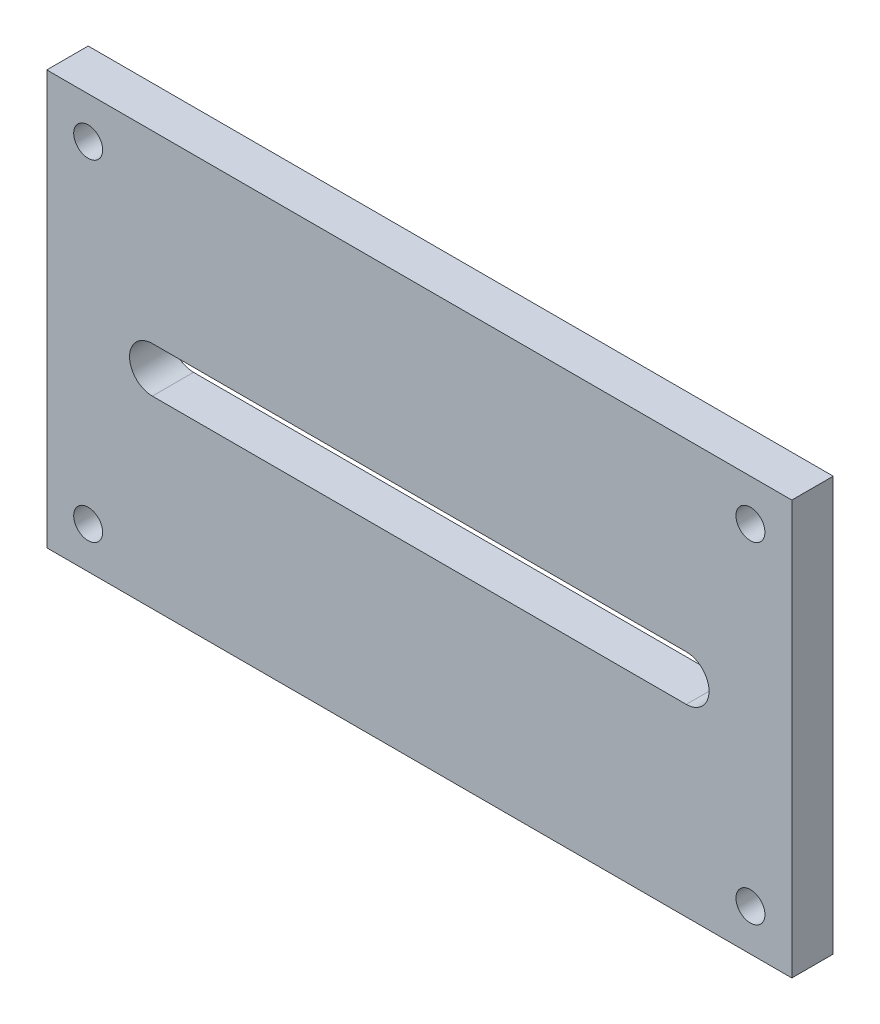
from build123d import *

# Parameters (mm, degrees)
SKETCH1_W                            = 90
SKETCH1_H                            = 50
BOSS_EXTRUDE1_DEPTH                  = 5
F_5_5_5_5_DIAMETER_SLOT1_DEPTH       = 5
F_3_5_3_5_DIAMETER_HOLE1_D           = 3.5
F_3_5_3_5_DIAMETER_HOLE1_CSINK_D     = 3.55
F_3_5_3_5_DIAMETER_HOLE1_CSINK_ANGLE = 90


with BuildPart() as part:
    # Sketch1 → Boss-Extrude1 (new body)
    with BuildSketch(Plane.XY):
        Rectangle(SKETCH1_W, SKETCH1_H)
    extrude(amount=BOSS_EXTRUDE1_DEPTH)

    # Ø5.5 (5.5) Diameter Slot1: read off the stored shape, not the designer's step
    # Ø5.5 (5.5) Diameter Slot1 outline → Ø5.5 (5.5) Diameter Slot1 (cut)
    with BuildSketch(Plane.XY):
        with BuildLine():
            ThreePointArc((32.25, -2.75), (35, 0), (32.25, 2.75))
            Line((32.25, 2.75), (-32.25, 2.75))
            ThreePointArc((-32.25, 2.75), (-35, 0), (-32.25, -2.75))
            Line((-32.25, -2.75), (32.25, -2.75))
        make_face()
    extrude(amount=F_5_5_5_5_DIAMETER_SLOT1_DEPTH, mode=Mode.SUBTRACT)

    # 5.5 _5.5_ Diameter Slot1 2: loft between two sections, ruled curve by curve
    f_5_5_5_5_diameter_slot1_2_from = [
        Edge.make_three_point_arc((32.25, 2.75, 0.025), (34.194543648, 1.944543648, 0.025), (35, 0, 0.025)),
        Edge.make_three_point_arc((35, 0, 0.025), (34.194543648, -1.944543648, 0.025), (32.25, -2.75, 0.025)),
        Edge.make_three_point_arc((-32.25, -2.75, 0.025), (-34.194543648, -1.944543648, 0.025), (-35, 0, 0.025)),
        Edge.make_three_point_arc((-35, 0, 0.025), (-34.194543648, 1.944543648, 0.025), (-32.25, 2.75, 0.025)),
        Edge.make_line((32.25, -2.75, 0.025), (-32.25, -2.75, 0.025)),
        Edge.make_line((32.25, 2.75, 0.025), (-32.25, 2.75, 0.025)),
    ]
    f_5_5_5_5_diameter_slot1_2_to = [
        Edge.make_three_point_arc((32.25, 2.775, 0), (34.212221318, 1.962221318, 0), (35.025, 0, 0)),
        Edge.make_three_point_arc((35.025, 0, 0), (34.212221318, -1.962221318, 0), (32.25, -2.775, 0)),
        Edge.make_three_point_arc((-32.25, -2.775, 0), (-34.212221318, -1.962221318, 0), (-35.025, 0, 0)),
        Edge.make_three_point_arc((-35.025, 0, 0), (-34.212221318, 1.962221318, 0), (-32.25, 2.775, 0)),
        Edge.make_line((32.25, -2.775, 0), (-32.25, -2.775, 0)),
        Edge.make_line((32.25, 2.775, 0), (-32.25, 2.775, 0)),
    ]
    f_5_5_5_5_diameter_slot1_2 = Solid(Shell([*[Face.make_surface_from_curves(f_5_5_5_5_diameter_slot1_2_from[k], f_5_5_5_5_diameter_slot1_2_to[k]) for k in range(6)], Face(Wire(f_5_5_5_5_diameter_slot1_2_from)), Face(Wire(f_5_5_5_5_diameter_slot1_2_to))]))
    add(f_5_5_5_5_diameter_slot1_2, mode=Mode.SUBTRACT)

    # Ø3.5 (3.5) Diameter Hole1 (through all)
    with Locations(Plane(origin=(0, 0, 0), x_dir=(-1, 0, 0), z_dir=(0, 0, -1))):
        with Locations((-40, 20), (40, 20), (40, -20), (-40, -20)):
            CounterSinkHole(F_3_5_3_5_DIAMETER_HOLE1_D / 2, F_3_5_3_5_DIAMETER_HOLE1_CSINK_D / 2, counter_sink_angle=F_3_5_3_5_DIAMETER_HOLE1_CSINK_ANGLE)


solid = part.part
